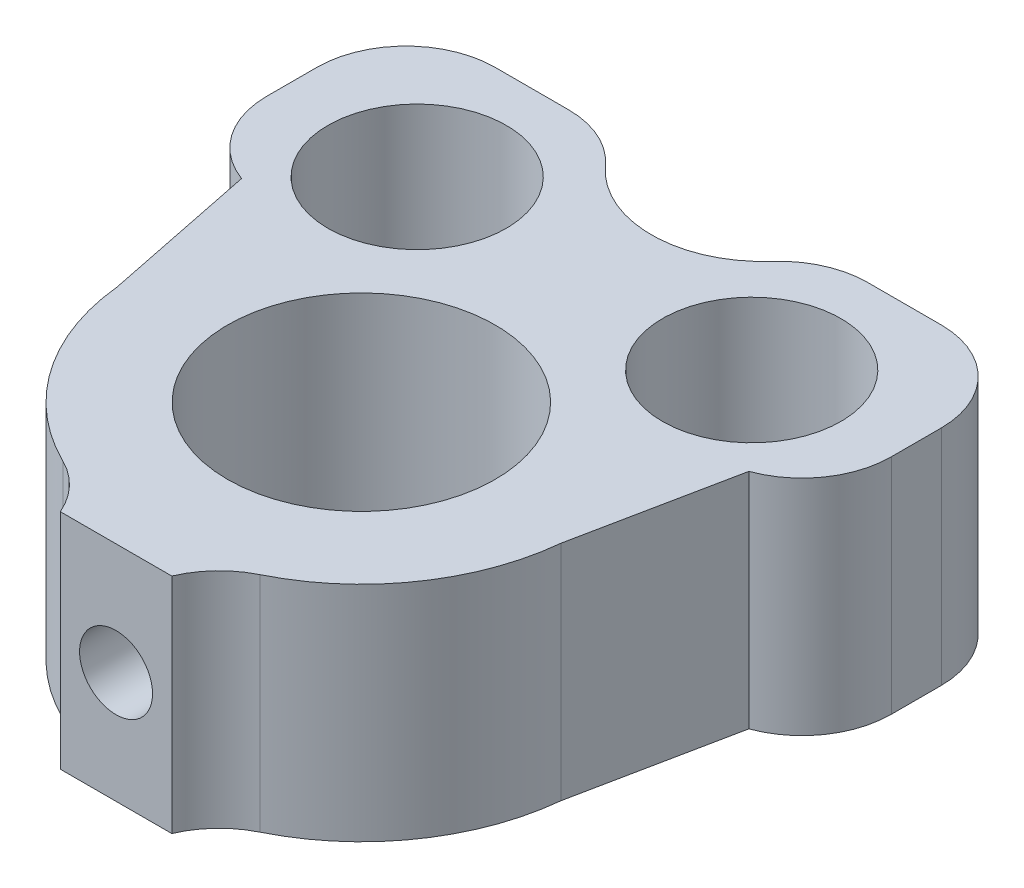
from build123d import *

# Parameters (mm, degrees)
CROQUIS1_R              = 10
CROQUIS1_R_2            = 6
SALIENTE_EXTRUIR1_DEPTH = 10
CROQUIS2_R              = 4
CORTAR_EXTRUIR1_DEPTH   = 10
CHAFL_N1_DEPTH          = 10
CROQUIS3_W              = 5
CROQUIS3_H              = 2
SALIENTE_EXTRUIR2_DEPTH = 10
CROQUIS4_R              = 1.635125
CORTAR_EXTRUIR2_DEPTH   = 10
REDONDEO2_R             = 4


with BuildPart() as part:
    # Croquis1 → Saliente-Extruir1 (new body)
    # profile 1 of 2: a face of its own
    with BuildSketch(Plane(origin=(0, 0, 0), x_dir=(1, 0, 0), z_dir=(0, 1, 0))):
        Circle(CROQUIS1_R)
        with Locations(Location((0, 0, 0), (0, 0, 270))):
            Circle(CROQUIS1_R_2, mode=Mode.SUBTRACT)
    # profile 2 of 2: a face of its own
    with BuildSketch(Plane(origin=(0, 0, 0), x_dir=(1, 0, 0), z_dir=(0, 1, 0))):
        with BuildLine():
            Line((-14, 16), (-4.582575695, 16))
            ThreePointArc((-4.582575695, 16), (0, 13), (4.582575695, 16))
            Line((4.582575695, 16), (14, 16))
            Line((14, 16), (14, 6))
            Line((14, 6), (-14, 6))
            Line((-14, 6), (-14, 16))
        make_face()
    extrude(amount=SALIENTE_EXTRUIR1_DEPTH)

    # Croquis2 → Cortar-Extruir1 (cut)
    with BuildSketch(Plane(origin=(0, 10, 0), x_dir=(1, 0, 0), z_dir=(0, 1, 0))):
        with Locations(Location((-7.5, 10, 0), (0, 0, 270))):
            Circle(CROQUIS2_R)
        with Locations(Location((7.5, 10, 0), (0, 0, 270))):
            Circle(CROQUIS2_R)
    extrude(amount=-CORTAR_EXTRUIR1_DEPTH, mode=Mode.SUBTRACT)

    # Chaflán1: read off the stored shape, not the designer's step
    # Chaflán1 outline → Chaflán1 (add)
    with BuildSketch(Plane(origin=(0, 0, 0), x_dir=(1, 0, 0), z_dir=(0, 1, 0))):
        with BuildLine():
            ThreePointArc((8, 6), (9.633249581, 2.68337521), (9.949874371, -1))
            Line((9.949874371, -1), (11.371284996, 6))
            Line((11.371284996, 6), (8, 6))
        make_face()
        with BuildLine():
            Line((-11.371284996, 6), (-9.949874371, -1))
            ThreePointArc((-9.949874371, -1), (-9.633249581, 2.68337521), (-8, 6))
            Line((-8, 6), (-11.371284996, 6))
        make_face()
    extrude(amount=CHAFL_N1_DEPTH)

    # Croquis3 → Saliente-Extruir2 (add)
    with BuildSketch(Plane(origin=(0, 0, 0), x_dir=(1, 0, 0), z_dir=(0, 1, 0))):
        with Locations((0, -10)):
            Rectangle(CROQUIS3_W, CROQUIS3_H)
    extrude(amount=SALIENTE_EXTRUIR2_DEPTH)

    # Croquis4 → Cortar-Extruir2 (cut)
    with BuildSketch(Plane.XY.offset(11)):
        with Locations((0, 5)):
            Circle(CROQUIS4_R)
    extrude(amount=-CORTAR_EXTRUIR2_DEPTH, mode=Mode.SUBTRACT)

    # Redondeo2
    # the kernel refuses this fillet: 4 mm, written as the material it adds along each edge
    with BuildSketch(Plane(origin=(2.5, 10, 9.682458366), x_dir=(0, 0, 1), z_dir=(0, -1, 0))) as redondeo2_piece_1:
        with BuildLine():
            CenterArc((2.878230853, -3.68296744), REDONDEO2_R, 112.965221116, 40.826178459)
            Line((-0.710537495, -1.916405314), (-0.782312862, -1.881074072))
            ThreePointArc((-0.782312862, -1.881074072), (-0.381189036, -0.948592301), (-0.077459667, 0.02))
            Line((-0.077459667, 0.02), (0, 0.08))
            ThreePointArc((0, 0.08), (0.658770817, 0.08), (1.28632785, 0.073659349))
            Line((1.28632785, 0.073659349), (1.317541634, 0))
        make_face()
    extrude(amount=10)
    with BuildSketch(Plane(origin=(-2.5, 10, 9.682458366), x_dir=(-0.9376279565956984, 0, -0.3476403529657844), z_dir=(0, -1, 0))) as redondeo2_piece_2:
        with BuildLine():
            CenterArc((2.452664045, -3.979057814), REDONDEO2_R, 95.865544119, 40.826178459)
            Line((-0.458030639, -1.23536387), (-0.516244533, -1.180489992))
            ThreePointArc((-0.516244533, -1.180489992), (-0.304025556, -0.589870707), (-0.075010237, 0.027811228))
            Line((-0.075010237, 0.027811228), (0.008175547, 0.079581156))
            ThreePointArc((0.008175547, 0.079581156), (1.021943352, 0.027644534), (2.035711158, 0.079581156))
            Line((2.035711158, 0.079581156), (2.043886705, 0))
        make_face()
    extrude(amount=10)
    # the kernel refuses this fillet: 4 mm, written as the material it takes off along each edge
    with BuildSketch(Plane(origin=(4.582575695, -5.314070594, -16), x_dir=(-0.5401558180759948, 0, 0.8415650255319863), z_dir=(0, 1, 0))) as redondeo2_2_piece_1:
        with BuildLine():
            CenterArc((2.218089643, 3.949477654), REDONDEO2_R, 212.694246687, 48.189685104)
            Line((-1.14817046, 1.788854382), (-1.215495662, 1.745641917))
            Line((-1.215495662, 1.745641917), (-0.067325202, -0.043212465))
            Line((-0.067325202, -0.043212465), (0.012674798, -0.078989553))
            ThreePointArc((0.012674798, -0.078989553), (0.792174872, -0.016847068), (1.571674947, -0.078989553))
            Line((1.571674947, -0.078989553), (1.584349745, 0))
        make_face()
    extrude(amount=20.628141188, mode=Mode.SUBTRACT)
    with BuildSketch(Plane(origin=(14, -10, -16), x_dir=(-1, 0, 0), z_dir=(0, 1, 0)), Plane(origin=(-14, -10, -16), x_dir=(0, 0, 1), z_dir=(0, 1, 0))) as redondeo2_2_piece_2:
        with BuildLine():
            CenterArc((REDONDEO2_R, REDONDEO2_R), REDONDEO2_R, 180, 90)
            Line((0, REDONDEO2_R), (-REDONDEO2_R * 0.02, REDONDEO2_R))
            Line((-REDONDEO2_R * 0.02, REDONDEO2_R), (-REDONDEO2_R * 0.02, -REDONDEO2_R * 0.02))
            Line((-REDONDEO2_R * 0.02, -REDONDEO2_R * 0.02), (REDONDEO2_R, -REDONDEO2_R * 0.02))
            Line((REDONDEO2_R, -REDONDEO2_R * 0.02), (REDONDEO2_R, 0))
        make_face()
    extrude(amount=30, mode=Mode.SUBTRACT)
    with BuildSketch(Plane(origin=(-4.582575695, -5.314070594, -16), x_dir=(-1, 0, 0), z_dir=(0, 1, 0))) as redondeo2_2_piece_3:
        with BuildLine():
            CenterArc((2.125628238, 4), REDONDEO2_R, 221.810314896, 48.189685104)
            Line((-0.855795732, 1.333333333), (-0.915424212, 1.28))
            ThreePointArc((-0.915424212, 1.28), (-0.442075769, 0.657566625), (-0.073321211, -0.032))
            Line((-0.073321211, -0.032), (0, -0.08))
            Line((0, -0.08), (2.125628238, -0.08))
            Line((2.125628238, -0.08), (2.125628238, 0))
        make_face()
    extrude(amount=20.628141188, mode=Mode.SUBTRACT)
    with BuildSketch(Plane(origin=(14, -9.394006553, -6), x_dir=(0, 0, -1), z_dir=(0, 1, 0))) as redondeo2_2_piece_4:
        with BuildLine():
            CenterArc((3.757602621, 4), REDONDEO2_R, 200.048853319, 69.951146681)
            Line((0, 2.628715004), (-0.075152052, 2.601289304))
            ThreePointArc((-0.075152052, 2.601289304), (-0.08, 1.314357502), (-0.08, 0))
            Line((-0.08, 0), (0, -0.08))
            Line((0, -0.08), (3.757602621, -0.08))
            Line((3.757602621, -0.08), (3.757602621, 0))
        make_face()
    extrude(amount=28.788013107, mode=Mode.SUBTRACT)
    with BuildSketch(Plane(origin=(-14, -9.394006553, -6), x_dir=(1, 0, 0), z_dir=(0, 1, 0))) as redondeo2_2_piece_5:
        with BuildLine():
            CenterArc((4, 3.757602621), REDONDEO2_R, 180, 69.951146681)
            Line((0, 3.757602621), (-0.08, 3.757602621))
            Line((-0.08, 3.757602621), (-0.08, 0))
            Line((-0.08, 0), (0, -0.08))
            ThreePointArc((0, -0.08), (1.314357502, -0.08), (2.601289304, -0.075152052))
            Line((2.601289304, -0.075152052), (2.628715004, 0))
        make_face()
    extrude(amount=28.788013107, mode=Mode.SUBTRACT)


solid = part.part
